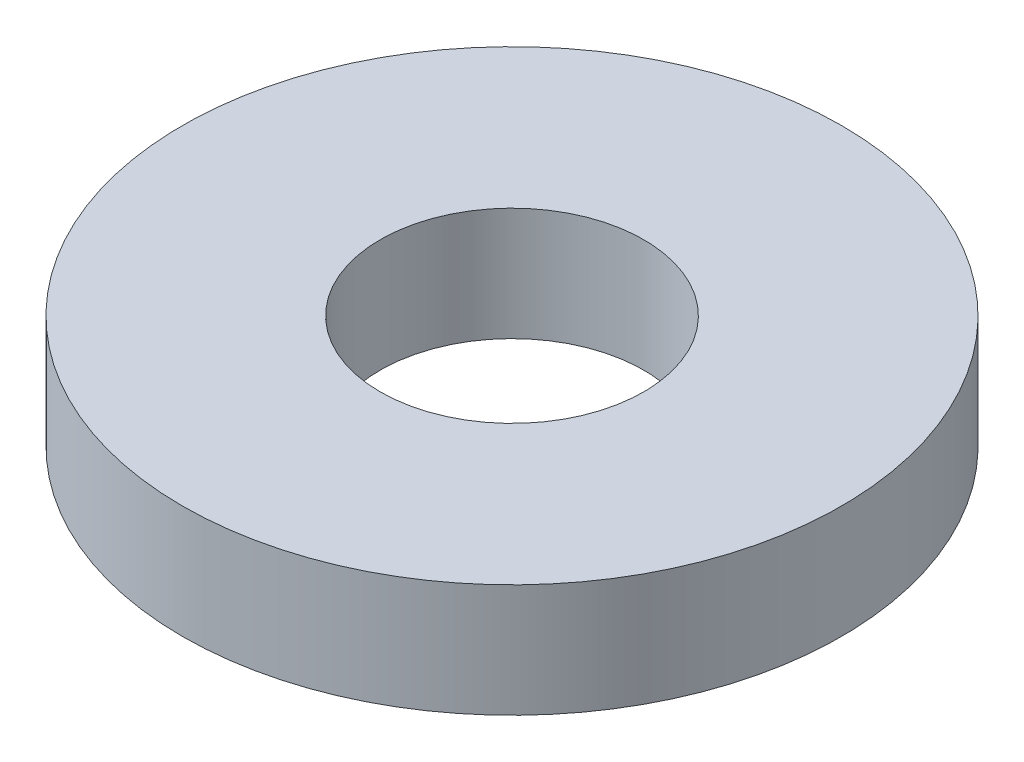
from build123d import *

# Parameters (mm, degrees)
SKETCH1_R           = 87.5
BOSS_EXTRUDE1_DEPTH = 30
SKETCH2_R           = 35
CUT_EXTRUDE1_DEPTH  = 128.328315782


with BuildPart() as part:
    # Sketch1 → Boss-Extrude1 (new body)
    with BuildSketch(Plane(origin=(0, 0, 0), x_dir=(1, 0, 0), z_dir=(0, 1, 0))):
        Circle(SKETCH1_R)
    extrude(amount=BOSS_EXTRUDE1_DEPTH)

    # Sketch2 → Cut-Extrude1 (cut, through all)
    with BuildSketch(Plane(origin=(0, 0, 0), x_dir=(1, 0, 0), z_dir=(0, 1, 0))):
        Circle(SKETCH2_R)
    extrude(amount=CUT_EXTRUDE1_DEPTH, mode=Mode.SUBTRACT)


solid = part.part
